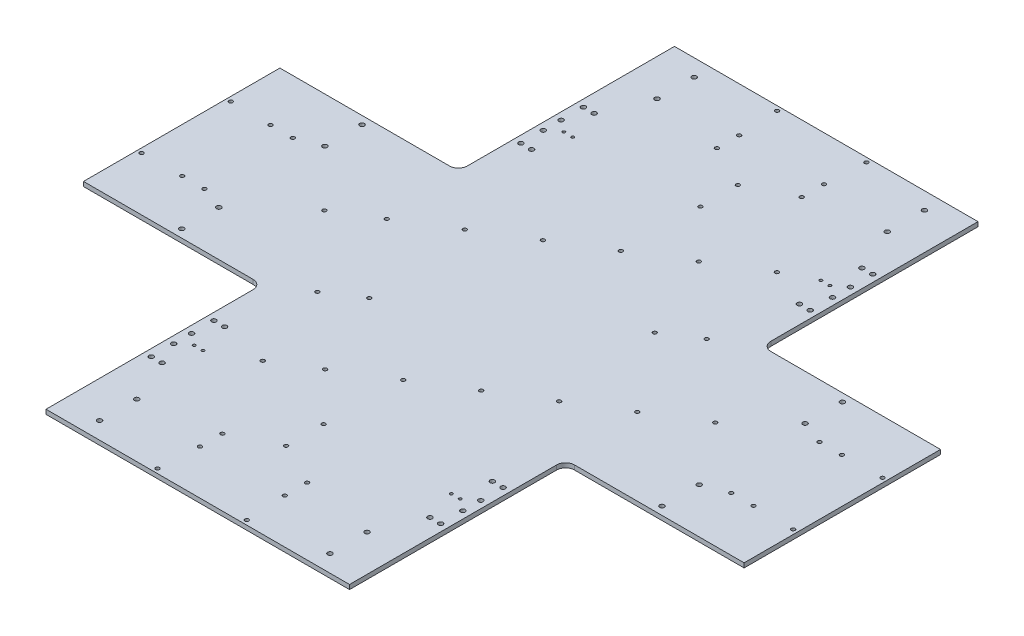
from build123d import *

# Parameters (mm, degrees)
BOSS_EXTRUDE1_DEPTH = 5
SKETCH2_R           = 2.125
CUT_EXTRUDE1_DEPTH  = 3
SKETCH4_R           = 2.6
SKETCH4_R_2         = 1.6
CUT_EXTRUDE3_DEPTH  = 10
SKETCH5_R           = 2.125
CUT_EXTRUDE4_DEPTH  = 10
FILLET1_R           = 10
SKETCH6_R           = 2.6
CUT_EXTRUDE5_DEPTH  = 10
SKETCH7_R           = 2.125
CUT_EXTRUDE6_DEPTH  = 10
SKETCH8_R           = 2.1
CUT_EXTRUDE7_DEPTH  = 10


with BuildPart() as part:
    # Sketch1 → Boss-Extrude1 (new body)
    with BuildSketch(Plane(origin=(0, 0, 0), x_dir=(1, 0, 0), z_dir=(0, 1, 0))):
        Polygon((170, 352), (-170, 352), (-170, 110), (-370, 110), (-370, -110), (-170, -110), (-170, -352), (170, -352), (170, -110), (370, -110), (370, 110), (170, 110), align=None)
    extrude(amount=BOSS_EXTRUDE1_DEPTH)

    # Sketch2 → Cut-Extrude1 (cut)
    with BuildSketch(Plane(origin=(0, 5, 0), x_dir=(1, 0, 0), z_dir=(0, 1, 0))):
        with Locations((320, 49.5)):
            Circle(SKETCH2_R)
        with Locations((295, 49.5)):
            Circle(SKETCH2_R)
        with Locations((295, -49.5)):
            Circle(SKETCH2_R)
        with Locations((320, -49.5)):
            Circle(SKETCH2_R)
        with Locations((-320, -49.5)):
            Circle(SKETCH2_R)
        with Locations((-295, -49.5)):
            Circle(SKETCH2_R)
        with Locations((-295, 49.5)):
            Circle(SKETCH2_R)
        with Locations((-320, 49.5)):
            Circle(SKETCH2_R)
        with Locations((47.5, 302)):
            Circle(SKETCH2_R)
        with Locations((47.5, 277)):
            Circle(SKETCH2_R)
        with Locations((-47.5, 277)):
            Circle(SKETCH2_R)
        with Locations((-47.5, 302)):
            Circle(SKETCH2_R)
        with Locations((-47.5, -302)):
            Circle(SKETCH2_R)
        with Locations((-47.5, -277)):
            Circle(SKETCH2_R)
        with Locations((47.5, -277)):
            Circle(SKETCH2_R)
        with Locations((47.5, -302)):
            Circle(SKETCH2_R)
    extrude(amount=-CUT_EXTRUDE1_DEPTH, mode=Mode.SUBTRACT)

    # Sketch4 → Cut-Extrude3 (cut)
    with BuildSketch(Plane(origin=(0, 5, 0), x_dir=(1, 0, 0), z_dir=(0, 1, 0))):
        with Locations((-162, 172)):
            Circle(SKETCH4_R)
        with Locations((-150, 172)):
            Circle(SKETCH4_R)
        with Locations((-162, 197)):
            Circle(SKETCH4_R)
        with Locations((-162, 217)):
            Circle(SKETCH4_R)
        with Locations((-162, 242)):
            Circle(SKETCH4_R)
        with Locations((-150, 242)):
            Circle(SKETCH4_R)
        with Locations((150, 242)):
            Circle(SKETCH4_R)
        with Locations((162, 242)):
            Circle(SKETCH4_R)
        with Locations((162, 217)):
            Circle(SKETCH4_R)
        with Locations((162, 197)):
            Circle(SKETCH4_R)
        with Locations((150, 172)):
            Circle(SKETCH4_R)
        with Locations((162, 172)):
            Circle(SKETCH4_R)
        with Locations((162, -172)):
            Circle(SKETCH4_R)
        with Locations((150, -172)):
            Circle(SKETCH4_R)
        with Locations((162, -197)):
            Circle(SKETCH4_R)
        with Locations((162, -217)):
            Circle(SKETCH4_R)
        with Locations((162, -242)):
            Circle(SKETCH4_R)
        with Locations((150, -242)):
            Circle(SKETCH4_R)
        with Locations((-150, -242)):
            Circle(SKETCH4_R)
        with Locations((-162, -242)):
            Circle(SKETCH4_R)
        with Locations((-162, -217)):
            Circle(SKETCH4_R)
        with Locations((-162, -197)):
            Circle(SKETCH4_R)
        with Locations((-150, -172)):
            Circle(SKETCH4_R)
        with Locations((-162, -172)):
            Circle(SKETCH4_R)
        with Locations((149, -207)):
            Circle(SKETCH4_R_2)
        with Locations((-149, -207)):
            Circle(SKETCH4_R_2)
        with Locations((149, 207)):
            Circle(SKETCH4_R_2)
        with Locations((-149, 207)):
            Circle(SKETCH4_R_2)
        with Locations((139, -207)):
            Circle(SKETCH4_R_2)
        with Locations((-139, -207)):
            Circle(SKETCH4_R_2)
        with Locations((139, 207)):
            Circle(SKETCH4_R_2)
        with Locations((-139, 207)):
            Circle(SKETCH4_R_2)
    extrude(amount=-CUT_EXTRUDE3_DEPTH, mode=Mode.SUBTRACT)

    # Sketch5 → Cut-Extrude4 (cut)
    with BuildSketch(Plane(origin=(0, 5, 0), x_dir=(1, 0, 0), z_dir=(0, 1, 0))):
        with Locations((-50, 347)):
            Circle(SKETCH5_R)
        with Locations((50, 347)):
            Circle(SKETCH5_R)
        with Locations((50, -347)):
            Circle(SKETCH5_R)
        with Locations((-50, -347)):
            Circle(SKETCH5_R)
        with Locations((-365, 50)):
            Circle(SKETCH5_R)
        with Locations((-365, -50)):
            Circle(SKETCH5_R)
        with Locations((365, -50)):
            Circle(SKETCH5_R)
        with Locations((365, 50)):
            Circle(SKETCH5_R)
    extrude(amount=-CUT_EXTRUDE4_DEPTH, mode=Mode.SUBTRACT)

    # Fillet1
    fillet1_edges = [part.edges().sort_by_distance(p)[0] for p in [
        (-170, 2.5, -110),
        (-170, 2.5, 110),
        (170, 2.5, 110),
        (170, 2.5, -110),
    ]]
    fillet(fillet1_edges, radius=FILLET1_R)

    # Sketch6 → Cut-Extrude5 (cut)
    with BuildSketch(Plane(origin=(0, 5, 0), x_dir=(1, 0, 0), z_dir=(0, 1, 0))):
        with Locations((129, 333)):
            Circle(SKETCH6_R)
        with Locations((129, 291.4)):
            Circle(SKETCH6_R)
        with Locations((129, -291.4)):
            Circle(SKETCH6_R)
        with Locations((129, -333)):
            Circle(SKETCH6_R)
        with Locations((-129, -333)):
            Circle(SKETCH6_R)
        with Locations((-129, -291.4)):
            Circle(SKETCH6_R)
        with Locations((-129, 291.4)):
            Circle(SKETCH6_R)
        with Locations((-129, 333)):
            Circle(SKETCH6_R)
        with Locations((269, 101)):
            Circle(SKETCH6_R)
        with Locations((269, 59.4)):
            Circle(SKETCH6_R)
        with Locations((269, -59.4)):
            Circle(SKETCH6_R)
        with Locations((269, -101)):
            Circle(SKETCH6_R)
        with Locations((-269, -101)):
            Circle(SKETCH6_R)
        with Locations((-269, -59.4)):
            Circle(SKETCH6_R)
        with Locations((-269, 59.4)):
            Circle(SKETCH6_R)
        with Locations((-269, 101)):
            Circle(SKETCH6_R)
    extrude(amount=-CUT_EXTRUDE5_DEPTH, mode=Mode.SUBTRACT)

    # Sketch7 → Cut-Extrude6 (cut)
    with BuildSketch(Plane(origin=(0, 5, 0), x_dir=(1, 0, 0), z_dir=(0, 1, 0))):
        with Locations((-55.682048102, 90.197059371)):
            Circle(SKETCH7_R)
        with Locations((-1.648904044, 123.553757998)):
            Circle(SKETCH7_R)
        with Locations((52.384240013, 156.910456625)):
            Circle(SKETCH7_R)
        with Locations((106.41738407, 190.267155252)):
            Circle(SKETCH7_R)
        with Locations((-109.715192159, 56.840360744)):
            Circle(SKETCH7_R)
        with Locations((-163.748336216, 23.483662117)):
            Circle(SKETCH7_R)
        with Locations((-206.974851462, -3.201696784)):
            Circle(SKETCH7_R)
        with Locations((-95.610755259, -183.595815527)):
            Circle(SKETCH7_R)
        with Locations((-52.384240013, -156.910456625)):
            Circle(SKETCH7_R)
        with Locations((1.648904044, -123.553757998)):
            Circle(SKETCH7_R)
        with Locations((217.781480273, 9.87303651)):
            Circle(SKETCH7_R)
        with Locations((163.748336216, -23.483662117)):
            Circle(SKETCH7_R)
        with Locations((109.715192159, -56.840360744)):
            Circle(SKETCH7_R)
        with Locations((55.682048102, -90.197059371)):
            Circle(SKETCH7_R)
    extrude(amount=-CUT_EXTRUDE6_DEPTH, mode=Mode.SUBTRACT)

    # Sketch8 → Cut-Extrude7 (cut)
    with BuildSketch(Plane(origin=(0, 5, 0), x_dir=(1, 0, 0), z_dir=(0, 1, 0))):
        with Locations((-131.902216078, -86.136982554)):
            Circle(SKETCH8_R)
        with Locations((-96.736459412, -63.172454296)):
            Circle(SKETCH8_R)
        with Locations((96.736459412, 63.172454296)):
            Circle(SKETCH8_R)
        with Locations((131.902216078, 86.136982554)):
            Circle(SKETCH8_R)
        with Locations((0, 253)):
            Circle(SKETCH8_R)
        with Locations((0, 211)):
            Circle(SKETCH8_R)
        with Locations((0, -211)):
            Circle(SKETCH8_R)
        with Locations((0, -253)):
            Circle(SKETCH8_R)
    extrude(amount=-CUT_EXTRUDE7_DEPTH, mode=Mode.SUBTRACT)


solid = part.part
